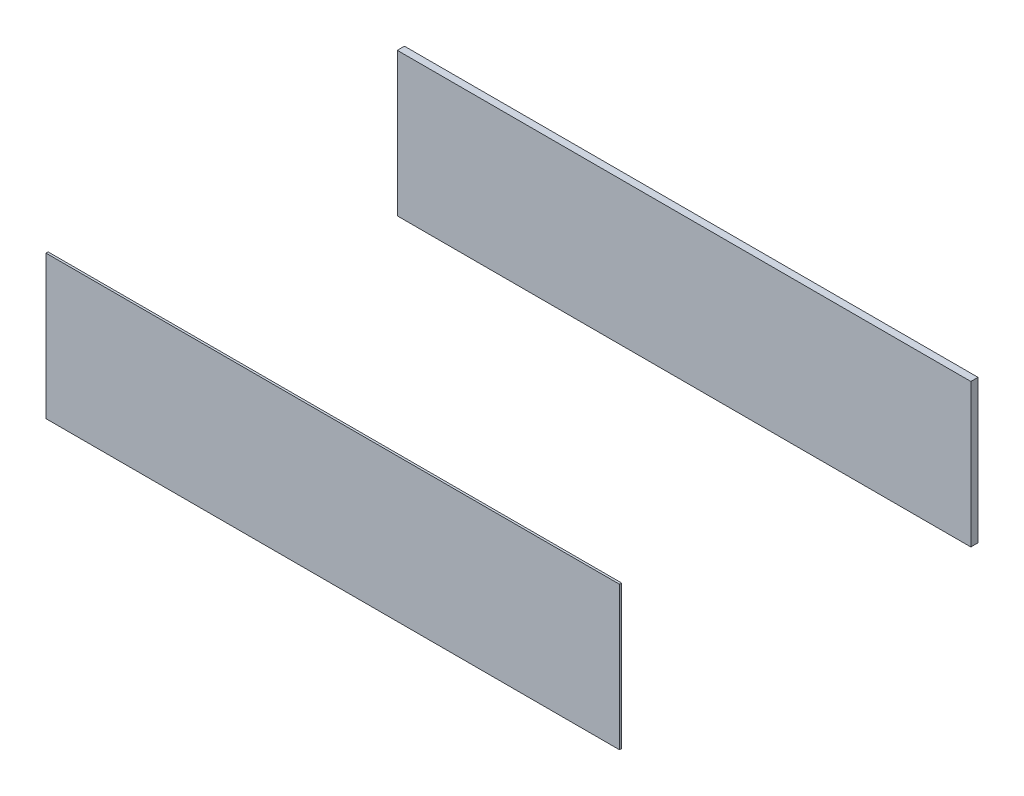
from build123d import *

# Parameters (mm, degrees)
SKETCH3_W             = 80
SKETCH3_H             = 1
BOSS_EXTRUDE1_DEPTH   = 20
SKETCH3_H_2           = 0.3
BOSS_EXTRUDE1_2_DEPTH = 20


with BuildPart() as part:
    # Sketch3 → Boss-Extrude1 (new body)
    with BuildSketch(Plane(origin=(0, 0, 0), x_dir=(1, 0, 0), z_dir=(0, 1, 0))):
        with Locations((0.188679245, 2.235849057)):
            Rectangle(SKETCH3_W, SKETCH3_H)
    extrude(amount=BOSS_EXTRUDE1_DEPTH)


with BuildPart() as body_2:
    # Sketch3 → Boss-Extrude1 2 (new body)
    with BuildSketch(Plane(origin=(0, 0, 0), x_dir=(1, 0, 0), z_dir=(0, 1, 0))):
        with Locations((0.188679245, -47.114150943)):
            Rectangle(SKETCH3_W, SKETCH3_H_2)
    extrude(amount=BOSS_EXTRUDE1_2_DEPTH)


solid = Compound([part.part, body_2.part])
